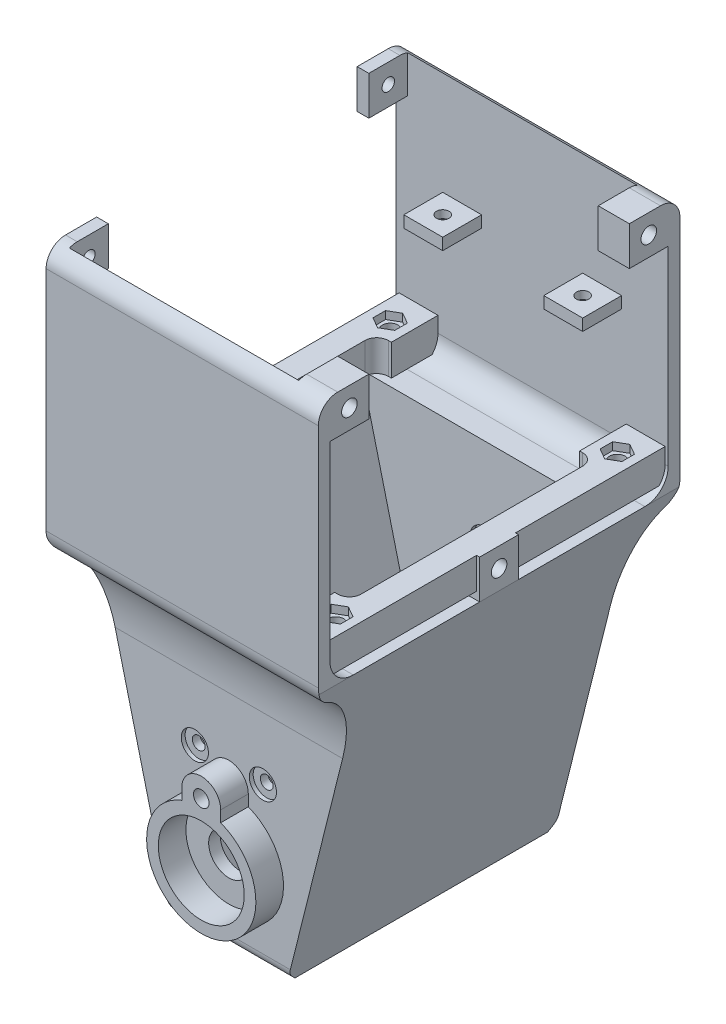
from build123d import *

# Parameters (mm, degrees)
SKETCH1_W                     = 70
SKETCH1_H                     = 145
BOSS_EXTRUDE1_DEPTH           = 3
SKETCH2_R                     = 5.2
SKETCH2_R_2                   = 1.65
CUT_EXTRUDE1_DEPTH            = 10
SKETCH3_W                     = 70
SKETCH3_H                     = 2
BOSS_EXTRUDE3_DEPTH           = 87
SKETCH5_W                     = 70
SKETCH5_H                     = 145
BOSS_EXTRUDE4_DEPTH           = 3
SKETCH6_R                     = 5.2
SKETCH6_R_2                   = 1.65
CUT_EXTRUDE2_DEPTH            = 4
SKETCH7_W                     = 20
SKETCH7_H                     = 4
CUT_EXTRUDE3_DEPTH            = 5
FILLET1_R                     = 2
FILLET2_R                     = 2
FILLET3_R                     = 2
FILLET5_R                     = 2
SKETCH9_R                     = 3.5
CUT_EXTRUDE5_DEPTH            = 1
CUT_EXTRUDE6_START            = -1
SKETCH10_R                    = 3.5
CUT_EXTRUDE6_DEPTH            = 1
SKETCH11_W                    = 8
SKETCH11_H                    = 40
CUT_EXTRUDE7_DEPTH            = 1.2
SKETCH12_W                    = 8
SKETCH12_H                    = 40
CUT_EXTRUDE8_DEPTH            = 1.2
FILLET17_R                    = 4
FILLET18_R                    = 4
CHAMFER1_SIZE                 = 80
CHAMFER1_SIZE2                = 20
CHAMFER2_SIZE                 = 80
CHAMFER2_SIZE2                = 20
CHAMFER3_SIZE                 = 20
CHAMFER3_SIZE2                = 80
CHAMFER4_SIZE                 = 20
CHAMFER4_SIZE2                = 80
SKETCH14_W                    = 75
SKETCH14_H                    = 87
CUT_EXTRUDE9_DEPTH            = 3
SKETCH19_W                    = 10
SKETCH19_H                    = 8
BOSS_EXTRUDE7_DEPTH           = 87
SKETCH20_R                    = 2
CUT_EXTRUDE11_DEPTH           = 6.6
CUT_EXTRUDE12_DEPTH           = 2
SPLIT1_SURFACE_1_BACK         = 186.941
SPLIT1_SURFACE_1_DEPTH        = 373.882
SPLIT1_SURFACE_2_BACK         = 186.941
SPLIT1_SURFACE_2_DEPTH        = 373.882
BODY_MOVE_COPY1_START         = 90
BODY_MOVE_COPY1_OUTLINE_R     = 5.2
BODY_MOVE_COPY1_OUTLINE_R_2   = 1.65
BODY_MOVE_COPY1_DEPTH         = 3
BODY_MOVE_COPY1_START_2       = 78
BODY_MOVE_COPY1_2_OUTLINE_R   = 3.5
BODY_MOVE_COPY1_2_DEPTH       = 3
BODY_MOVE_COPY1_START_3       = 79.2
BODY_MOVE_COPY1_3_DEPTH       = 1.8
BODY_MOVE_COPY1_4_OUTLINE_R   = 3.5
BODY_MOVE_COPY1_4_OUTLINE_R_2 = 1.65
BODY_MOVE_COPY1_4_DEPTH       = 2
BOSS_EXTRUDE11_DEPTH          = 12
BOSS_EXTRUDE12_DEPTH          = 12
FILLET19_SIZE                 = 20
FILLET19_SIZE_2               = 12
FILLET24_SIZE                 = 20
FILLET24_SIZE_2               = 12
BOSS_EXTRUDE14_DEPTH          = 64
SKETCH42_R                    = 11.05
SKETCH42_R_2                  = 2
BOSS_EXTRUDE15_DEPTH          = 7.1
SKETCH43_R                    = 11.05
SKETCH43_R_2                  = 2
BOSS_EXTRUDE16_DEPTH          = 7.1
SKETCH44_R                    = 2
BOSS_EXTRUDE17_DEPTH          = 2.5
SKETCH45_R                    = 2
BOSS_EXTRUDE18_DEPTH          = 2.5
SKETCH48_W                    = 7
SKETCH48_H                    = 10
BOSS_EXTRUDE19_DEPTH          = 10
FILLET38_R                    = 4
SKETCH49_R                    = 1.6
CUT_EXTRUDE15_DEPTH           = 12
SKETCH50_R                    = 2
CUT_EXTRUDE16_DEPTH           = 4.6
FILLET39_R                    = 6
FILLET40_R                    = 6
SKETCH56_W                    = 10
SKETCH56_H                    = 3
SKETCH56_W_2                  = 8
SKETCH56_H_2                  = 10
SKETCH56_W_3                  = 3
BOSS_EXTRUDE24_DEPTH          = 10
SKETCH55_W                    = 10
SKETCH55_H                    = 3
SKETCH55_W_2                  = 3
SKETCH55_H_2                  = 10
SKETCH55_W_3                  = 8
BOSS_EXTRUDE23_DEPTH          = 10
SKETCH57_R                    = 1.6
CUT_EXTRUDE21_DEPTH           = 3
CUT_EXTRUDE18_DEPTH           = 8
SKETCH63_R                    = 2
CUT_EXTRUDE23_DEPTH           = 6.8
SKETCH62_R                    = 1.6
CUT_EXTRUDE22_DEPTH           = 3
FILLET42_R                    = 5
CUT_EXTRUDE24_DEPTH           = 1
CHAMFER5_SIZE                 = 2
FILLET43_R                    = 3


# Read off the part's stored shape, not the designer's step: Body-Move/Copy1
# Some blends are built 0.0001 mm under size
with BuildPart() as part:
    # Sketch1 → Boss-Extrude1 (new body)
    with BuildSketch(Plane.XY):
        with Locations((35, 72.5)):
            Rectangle(SKETCH1_W, SKETCH1_H)
    extrude(amount=BOSS_EXTRUDE1_DEPTH)

    # Sketch2 → Cut-Extrude1 (cut)
    with BuildSketch(Plane.XY.offset(3)):
        with Locations((35, 21)):
            Circle(SKETCH2_R)
        with Locations((26.25, 41)):
            Circle(SKETCH2_R_2)
        with Locations((43.75, 41)):
            Circle(SKETCH2_R_2)
    extrude(amount=-CUT_EXTRUDE1_DEPTH, mode=Mode.SUBTRACT)

    # Sketch3 → Boss-Extrude3 (add)
    with BuildSketch(Plane.XY.offset(3)):
        with Locations((35, 113)):
            Rectangle(SKETCH3_W, SKETCH3_H)
    extrude(amount=BOSS_EXTRUDE3_DEPTH)

    # Sketch5 → Boss-Extrude4 (add)
    with BuildSketch(Plane.XY.offset(90)):
        with Locations((35, 72.5)):
            Rectangle(SKETCH5_W, SKETCH5_H)
    extrude(amount=BOSS_EXTRUDE4_DEPTH)

    # Sketch6 → Cut-Extrude2 (cut)
    with BuildSketch(Plane.XY.offset(93)):
        with Locations((35, 21)):
            Circle(SKETCH6_R)
        with Locations((26.25, 41)):
            Circle(SKETCH6_R_2)
        with Locations((43.75, 41)):
            Circle(SKETCH6_R_2)
    extrude(amount=-CUT_EXTRUDE2_DEPTH, mode=Mode.SUBTRACT)

    # Sketch7 → Cut-Extrude3 (cut)
    with BuildSketch(Plane(origin=(0, 114, 0), x_dir=(1, 0, 0), z_dir=(0, 1, 0))):
        with Locations((35, -88)):
            Rectangle(SKETCH7_W, SKETCH7_H)
        with Locations((35, -5)):
            Rectangle(SKETCH7_W, SKETCH7_H)
    extrude(amount=-CUT_EXTRUDE3_DEPTH, mode=Mode.SUBTRACT)

    # Fillet1
    fillet1_edges = [part.edges().sort_by_distance(p)[0] for p in [
        (25, 113, 86),
    ]]
    fillet(fillet1_edges, radius=FILLET1_R)

    # Fillet2
    fillet2_edges = [part.edges().sort_by_distance(p)[0] for p in [
        (45, 113, 86),
    ]]
    fillet(fillet2_edges, radius=FILLET2_R)

    # Fillet3
    fillet3_edges = [part.edges().sort_by_distance(p)[0] for p in [
        (25, 113, 7),
    ]]
    fillet(fillet3_edges, radius=FILLET3_R)

    # Fillet5
    fillet5_edges = [part.edges().sort_by_distance(p)[0] for p in [
        (45, 113, 7),
    ]]
    fillet(fillet5_edges, radius=FILLET5_R)

    # Sketch9 → Cut-Extrude5 (cut)
    with BuildSketch(Plane.XY.offset(93)):
        with Locations((26.25, 41)):
            Circle(SKETCH9_R)
        with Locations((43.75, 41)):
            Circle(SKETCH9_R)
    extrude(amount=-CUT_EXTRUDE5_DEPTH, mode=Mode.SUBTRACT)

    # Sketch10 → Cut-Extrude6 (cut)
    with BuildSketch(Plane(origin=(0, 0, 0), x_dir=(-1, 0, 0), z_dir=(0, 0, -1)).offset(CUT_EXTRUDE6_START)):
        with Locations(Location((-43.75, 41, 0), (0, 0, 180))):
            Circle(SKETCH10_R)
        with Locations(Location((-26.25, 41, 0), (0, 0, 180))):
            Circle(SKETCH10_R)
    extrude(amount=CUT_EXTRUDE6_DEPTH, mode=Mode.SUBTRACT)

    # Sketch11 → Cut-Extrude7 (cut)
    with BuildSketch(Plane.XY.offset(3)):
        with Locations((35, 41)):
            Rectangle(SKETCH11_W, SKETCH11_H)
    extrude(amount=-CUT_EXTRUDE7_DEPTH, mode=Mode.SUBTRACT)

    # Sketch12 → Cut-Extrude8 (cut)
    with BuildSketch(Plane(origin=(0, 0, 90), x_dir=(-1, 0, 0), z_dir=(0, 0, -1))):
        with Locations((-35, 41)):
            Rectangle(SKETCH12_W, SKETCH12_H)
    extrude(amount=-CUT_EXTRUDE8_DEPTH, mode=Mode.SUBTRACT)

    # Fillet17
    fillet17_edges = [part.edges().sort_by_distance(p)[0] for p in [
        (39, 61, 90.6),
        (31, 61, 90.6),
    ]]
    fillet(fillet17_edges, radius=FILLET17_R - 0.0001)  # a hair under: the kernel refuses the full size

    # Fillet18
    fillet18_edges = [part.edges().sort_by_distance(p)[0] for p in [
        (39, 61, 2.4),
        (31, 61, 2.4),
    ]]
    fillet(fillet18_edges, radius=FILLET18_R - 0.0001)  # a hair under: the kernel refuses the full size

    # Chamfer1
    chamfer1_edges = [part.edges().sort_by_distance(p)[0] for p in [
        (0, 0, 91.5),
    ]]
    chamfer1_side = [part.faces().sort_by_distance(p)[0] for p in [
        (0, 1.722614292, 91.5),
    ]]
    chamfer(chamfer1_edges, length=CHAMFER1_SIZE, length2=CHAMFER1_SIZE2, reference=chamfer1_side[0])

    # Chamfer2
    chamfer2_edges = [part.edges().sort_by_distance(p)[0] for p in [
        (0, 0, 1.5),
    ]]
    chamfer2_side = [part.faces().sort_by_distance(p)[0] for p in [
        (0, 112.5, 91.277385708),
    ]]
    chamfer(chamfer2_edges, length=CHAMFER2_SIZE, length2=CHAMFER2_SIZE2, reference=chamfer2_side[0])

    # Chamfer3
    chamfer3_edges = [part.edges().sort_by_distance(p)[0] for p in [
        (70, 0, 91.5),
    ]]
    chamfer3_side = [part.faces().sort_by_distance(p)[0] for p in [
        (45, 0, 91.5),
    ]]
    chamfer(chamfer3_edges, length=CHAMFER3_SIZE, length2=CHAMFER3_SIZE2, reference=chamfer3_side[0])

    # Chamfer4
    chamfer4_edges = [part.edges().sort_by_distance(p)[0] for p in [
        (70, 0, 1.5),
    ]]
    chamfer4_side = [part.faces().sort_by_distance(p)[0] for p in [
        (45, 0, 1.5),
    ]]
    chamfer(chamfer4_edges, length=CHAMFER4_SIZE, length2=CHAMFER4_SIZE2, reference=chamfer4_side[0])

    # Sketch14 → Cut-Extrude9 (cut)
    with BuildSketch(Plane(origin=(0, 114, 0), x_dir=(1, 0, 0), z_dir=(0, 1, 0))):
        with Locations((37.5, -46.5)):
            Rectangle(SKETCH14_W, SKETCH14_H)
    extrude(amount=-CUT_EXTRUDE9_DEPTH, mode=Mode.SUBTRACT)


with BuildPart() as cut_extrude9_piece_1:
    # of the separate pieces the step leaves, piece 1, a body of its own (cut_extrude9_pieces)
    add(part.part.solids().sort_by_distance((70, 80, 90))[0])



with BuildPart() as cut_extrude9_piece_2:
    # of the separate pieces the step leaves, piece 2, a body of its own (cut_extrude9_pieces)
    add(part.part.solids().sort_by_distance((70, 145, 3))[0])


with BuildPart() as cut_extrude9_piece_1_1:
    add(cut_extrude9_piece_1.part)

    add(cut_extrude9_piece_2.part)  # Boss-Extrude7 merges Cut-Extrude9 piece 2
    # Sketch19 → Boss-Extrude7 (add)
    with BuildSketch(Plane(origin=(0, 0, 90), x_dir=(-1, 0, 0), z_dir=(0, 0, -1))):
        with Locations((-64.21, 86)):
            Rectangle(SKETCH19_W, SKETCH19_H)
        with Locations((-5.79, 86)):
            Rectangle(SKETCH19_W, SKETCH19_H)
    extrude(amount=BOSS_EXTRUDE7_DEPTH)

    # Sketch20 → Cut-Extrude11 (cut)
    with BuildSketch(Plane(origin=(0, 90, 0), x_dir=(1, 0, 0), z_dir=(0, 1, 0))):
        with Locations(Location((64.21, -10.305, 0), (0, 0, 270))):
            Circle(SKETCH20_R)
        with Locations(Location((64.21, -82.695, 0), (0, 0, 270))):
            Circle(SKETCH20_R)
        with Locations(Location((5.79, -10.305, 0), (0, 0, 270))):
            Circle(SKETCH20_R)
        with Locations(Location((5.79, -82.695, 0), (0, 0, 270))):
            Circle(SKETCH20_R)
    extrude(amount=-CUT_EXTRUDE11_DEPTH, mode=Mode.SUBTRACT)

    # Sketch22 → Cut-Extrude12 (cut)
    with BuildSketch(Plane(origin=(0, 90, 0), x_dir=(1, 0, 0), z_dir=(0, 1, 0))):
        Polygon((2.99, -8.688419246), (2.99, -11.921580754), (5.79, -13.538161507), (8.59, -11.921580754), (8.59, -8.688419246), (5.79, -7.071838493), align=None)
        Polygon((61.41, -8.688419246), (61.41, -11.921580754), (64.21, -13.538161507), (67.01, -11.921580754), (67.01, -8.688419246), (64.21, -7.071838493), align=None)
        Polygon((67.01, -81.078419246), (64.21, -79.461838493), (61.41, -81.078419246), (61.41, -84.311580754), (64.21, -85.928161507), (67.01, -84.311580754), align=None)
        Polygon((2.99, -81.078419246), (2.99, -84.311580754), (5.79, -85.928161507), (8.59, -84.311580754), (8.59, -81.078419246), (5.79, -79.461838493), align=None)
    extrude(amount=-CUT_EXTRUDE12_DEPTH, mode=Mode.SUBTRACT)


with BuildPart() as body_2:
    # Split1: the piece behind the surface
    add(cut_extrude9_piece_1_1.part)
    # Split1 surface: a surface, the sketch's curves swept straight by 373.882 mm
    with BuildLine(Plane.XY.offset(-SPLIT1_SURFACE_1_BACK), mode=Mode.PRIVATE) as split1_surface_1_path:
        Line((70, 80), (0, 80))
    split1_surface_1 = Shell.extrude(split1_surface_1_path.wire(), (0 * SPLIT1_SURFACE_1_DEPTH, 0 * SPLIT1_SURFACE_1_DEPTH, 1 * SPLIT1_SURFACE_1_DEPTH))
    split(bisect_by=split1_surface_1, keep=Keep.BOTTOM)



with BuildPart() as cut_extrude9_piece_1_2:
    add(cut_extrude9_piece_1_1.part)

    # Split1: split by a surface, the side it looks to stays
    # Split1 surface: a surface, the sketch's curves swept straight by 373.882 mm
    with BuildLine(Plane.XY.offset(-SPLIT1_SURFACE_2_BACK), mode=Mode.PRIVATE) as split1_surface_2_path:
        Line((70, 80), (0, 80))
    split1_surface_2 = Shell.extrude(split1_surface_2_path.wire(), (0 * SPLIT1_SURFACE_2_DEPTH, 0 * SPLIT1_SURFACE_2_DEPTH, 1 * SPLIT1_SURFACE_2_DEPTH))
    split(bisect_by=split1_surface_2, keep=Keep.TOP)

    # Body-Move/Copy1 outline → Body-Move/Copy1 (cut)
    with BuildSketch(Plane.XY.offset(BODY_MOVE_COPY1_START)):
        Polygon((50, 0), (70, 80), (0, 80), (20, 0), align=None)
        with Locations((35, 21)):
            Circle(BODY_MOVE_COPY1_OUTLINE_R, mode=Mode.SUBTRACT)
        with Locations((26.25, 41)):
            Circle(BODY_MOVE_COPY1_OUTLINE_R_2, mode=Mode.SUBTRACT)
        with Locations((43.75, 41)):
            Circle(BODY_MOVE_COPY1_OUTLINE_R_2, mode=Mode.SUBTRACT)
    extrude(amount=BODY_MOVE_COPY1_DEPTH, mode=Mode.SUBTRACT)


with BuildPart() as body_3:
    # Body-Move_Copy1 2 outline → Body-Move_Copy1 2 (new body)
    with BuildSketch(Plane.XY.offset(BODY_MOVE_COPY1_START_2)):
        Polygon((50, 0), (70, 80), (0, 80), (20, 0), align=None)
        with BuildLine():
            Line((31, 24.322649545), (31, 57))
            ThreePointArc((31, 57), (32.171572875, 59.828427125), (35, 61))
            ThreePointArc((35, 61), (37.828427125, 59.828427125), (39, 57))
            Line((39, 57), (39, 24.322649545))
            ThreePointArc((39, 24.322649545), (35, 15.8), (31, 24.322649545))
        make_face(mode=Mode.SUBTRACT)
        with Locations((26.25, 41)):
            Circle(BODY_MOVE_COPY1_2_OUTLINE_R, mode=Mode.SUBTRACT)
        with Locations((43.75, 41)):
            Circle(BODY_MOVE_COPY1_2_OUTLINE_R, mode=Mode.SUBTRACT)
    extrude(amount=BODY_MOVE_COPY1_2_DEPTH)

    # Body-Move_Copy1 3 outline → Body-Move_Copy1 3 (add)
    with BuildSketch(Plane.XY.offset(BODY_MOVE_COPY1_START_3)):
        with BuildLine():
            ThreePointArc((35, 61), (32.171572875, 59.828427125), (31, 57))
            Line((31, 57), (31, 24.322649545))
            ThreePointArc((31, 24.322649545), (35, 26.2), (39, 24.322649545))
            Line((39, 24.322649545), (39, 57))
            ThreePointArc((39, 57), (37.828427125, 59.828427125), (35, 61))
        make_face()
    extrude(amount=BODY_MOVE_COPY1_3_DEPTH)

    # Body-Move_Copy1 4 outline → Body-Move_Copy1 4 (add)
    # profile 1 of 2: a face of its own
    with BuildSketch(Plane.XY.offset(BODY_MOVE_COPY1_START_2)):
        with Locations((43.75, 41)):
            Circle(BODY_MOVE_COPY1_4_OUTLINE_R)
        with Locations((43.75, 41)):
            Circle(BODY_MOVE_COPY1_4_OUTLINE_R_2, mode=Mode.SUBTRACT)
    # profile 2 of 2: a face of its own
    with BuildSketch(Plane.XY.offset(BODY_MOVE_COPY1_START_2)):
        with Locations((26.25, 41)):
            Circle(BODY_MOVE_COPY1_4_OUTLINE_R)
        with Locations((26.25, 41)):
            Circle(BODY_MOVE_COPY1_4_OUTLINE_R_2, mode=Mode.SUBTRACT)
    extrude(amount=BODY_MOVE_COPY1_4_DEPTH)


with BuildPart() as cut_extrude9_piece_1_3:
    # Body-Move/Copy2: moved
    add(cut_extrude9_piece_1_2.part.moved(Location((0, 0, 12))))



with BuildPart() as body_2_1:
    add(body_2.part)

    add(body_3.part)  # Boss-Extrude11 merges body 3
    # Sketch35 → Boss-Extrude11 (add)
    with BuildSketch(Plane.XY.offset(81)):
        Polygon((0.75, 77), (69.25, 77), (70, 80), (0, 80), align=None)
    extrude(amount=BOSS_EXTRUDE11_DEPTH)


with BuildPart() as cut_extrude9_piece_1_4:
    add(cut_extrude9_piece_1_3.part)

    add(body_2_1.part)  # Boss-Extrude12 merges body 2
    # Sketch36 → Boss-Extrude12 (add)
    with BuildSketch(Plane(origin=(0, 0, 12), x_dir=(-1, 0, 0), z_dir=(0, 0, -1))):
        Polygon((-69.25, 77), (-0.75, 77), (0, 80), (-70, 80), align=None)
    extrude(amount=BOSS_EXTRUDE12_DEPTH)

    # Fillet19
    # an asymmetric fillet: 20, 12 mm, written as the material it adds along each edge
    with BuildSketch(Plane(origin=(-49.25, 77, 81), x_dir=(0, -1, 0), z_dir=(1, 0, 0))) as fillet19_piece_1_section:
        with BuildLine():
            Bezier((FILLET19_SIZE, 0), (0, 0), (0, -FILLET19_SIZE_2), weights=[1, 0.707106781, 1])
            Line((0, -FILLET19_SIZE_2), (0, 0))
            Line((0, 0), (FILLET19_SIZE, 0))
        make_face()
    fillet19_piece_1 = extrude(amount=168.5, mode=Mode.PRIVATE)
    fillet19_piece_1 = split(fillet19_piece_1, bisect_by=Plane(origin=(66.144010616, 64.576042464, 83.616125615), z_dir=(-0.9701425001453319, 0.24253562503633297, 0)), keep=Keep.TOP, mode=Mode.PRIVATE)
    fillet19_piece_1 = split(fillet19_piece_1, bisect_by=Plane(origin=(3.855990617, 64.576037532, 83.616125615), z_dir=(0.9701425001453319, 0.24253562503633297, 0)), keep=Keep.TOP, mode=Mode.PRIVATE)
    add(fillet19_piece_1)

    # Fillet24
    # an asymmetric fillet: 20, 12 mm, written as the material it adds along each edge
    with BuildSketch(Plane(origin=(119.25, 77, 12), x_dir=(0, -1, 0), z_dir=(-1, 0, 0))) as fillet24_piece_1_section:
        with BuildLine():
            Bezier((FILLET24_SIZE, 0), (0, 0), (0, -FILLET24_SIZE_2), weights=[1, 0.707106781, 1])
            Line((0, -FILLET24_SIZE_2), (0, 0))
            Line((0, 0), (FILLET24_SIZE, 0))
        make_face()
    fillet24_piece_1 = extrude(amount=168.5, mode=Mode.PRIVATE)
    fillet24_piece_1 = split(fillet24_piece_1, bisect_by=Plane(origin=(3.85598727, 64.576050922, 9.383876989), z_dir=(0.9701425001453319, 0.24253562503633297, 0)), keep=Keep.TOP, mode=Mode.PRIVATE)
    fillet24_piece_1 = split(fillet24_piece_1, bisect_by=Plane(origin=(66.14401273, 64.576050922, 9.383876989), z_dir=(-0.970142500145332, 0.24253562503633283, 0)), keep=Keep.TOP, mode=Mode.PRIVATE)
    add(fillet24_piece_1)

    # Sketch41 → Boss-Extrude14 (add)
    with BuildSketch(Plane(origin=(0, 0, 78), x_dir=(-1, 0, 0), z_dir=(0, 0, -1))):
        Polygon((-66.907670781, 80), (-47.657670781, 3), (-22.342329219, 3), (-3.092329219, 80), (0, 80), (-20, 0), (-50, 0), (-70, 80), align=None)
    extrude(amount=BOSS_EXTRUDE14_DEPTH)

    # Sketch42 → Boss-Extrude15 (add)
    with BuildSketch(Plane.XY.offset(81)):
        with BuildLine():
            Line((40, 37), (40, 34.13021325))
            ThreePointArc((40, 34.13021325), (35, 6.95), (30, 34.13021325))
            Line((30, 34.13021325), (30, 37))
            ThreePointArc((30, 37), (35, 42), (40, 37))
        make_face()
        with Locations((35, 21)):
            Circle(SKETCH42_R, mode=Mode.SUBTRACT)
        with Locations((35, 37)):
            Circle(SKETCH42_R_2, mode=Mode.SUBTRACT)
    extrude(amount=BOSS_EXTRUDE15_DEPTH)

    # Sketch43 → Boss-Extrude16 (add)
    with BuildSketch(Plane(origin=(0, 0, 12), x_dir=(-1, 0, 0), z_dir=(0, 0, -1))):
        with BuildLine():
            Line((-30, 37), (-30, 34.13021325))
            ThreePointArc((-30, 34.13021325), (-35, 6.95), (-40, 34.13021325))
            Line((-40, 34.13021325), (-40, 37))
            ThreePointArc((-40, 37), (-35, 42), (-30, 37))
        make_face()
        with Locations(Location((-35, 21, 0), (0, 0, 180))):
            Circle(SKETCH43_R, mode=Mode.SUBTRACT)
        with Locations(Location((-35, 37, 0), (0, 0, 180))):
            Circle(SKETCH43_R_2, mode=Mode.SUBTRACT)
    extrude(amount=BOSS_EXTRUDE16_DEPTH)

    # Sketch44 → Boss-Extrude17 (add)
    with BuildSketch(Plane.XY.offset(81)):
        with Locations((35, 37)):
            Circle(SKETCH44_R)
    extrude(amount=BOSS_EXTRUDE17_DEPTH)

    # Sketch45 → Boss-Extrude18 (add)
    with BuildSketch(Plane(origin=(0, 0, 12), x_dir=(-1, 0, 0), z_dir=(0, 0, -1))):
        with Locations(Location((-35, 37, 0), (0, 0, 180))):
            Circle(SKETCH45_R)
    extrude(amount=BOSS_EXTRUDE18_DEPTH)

    # Sketch48 → Boss-Extrude19 (add)
    with BuildSketch(Plane(origin=(0, 80, 0), x_dir=(1, 0, 0), z_dir=(0, 1, 0))):
        with Locations((3.5, -46.5)):
            Rectangle(SKETCH48_W, SKETCH48_H)
        with Locations((66.5, -46.5)):
            Rectangle(SKETCH48_W, SKETCH48_H)
    extrude(amount=BOSS_EXTRUDE19_DEPTH)

    # Fillet38
    # the kernel refuses this fillet: 4 mm, written as the material it adds along each edge
    with BuildSketch(Plane(origin=(3.092329219, 80, 51.5), x_dir=(0.24253562503632958, -0.9701425001453328, 0), z_dir=(0, 0, -1))) as fillet38_piece_1:
        with BuildLine():
            CenterArc((4.942285388, -4), FILLET38_R, 90, 87.004895833)
            Line((0.947749375, -3.790997501), (0, 0))
            Line((0, 0), (4.942285388, 0))
        make_face()
    extrude(amount=10)
    with BuildSketch(Plane(origin=(66.907670781, 80, 51.5), x_dir=(-0.2425356250363303, -0.9701425001453327, 0), z_dir=(0, 0, -1))) as fillet38_piece_2:
        with BuildLine():
            CenterArc((4.942285388, 4), FILLET38_R, 182.995104167, 87.004895833)
            Line((0.947749375, 3.790997501), (0, 0))
            Line((0, 0), (4.942285388, 0))
        make_face()
    extrude(amount=10)

    # Sketch49 → Cut-Extrude15 (cut)
    with BuildSketch(Plane.ZY):
        with Locations(Location((46.5, 85, 0), (0, 0, 270))):
            Circle(SKETCH49_R)
    extrude(amount=-CUT_EXTRUDE15_DEPTH, mode=Mode.SUBTRACT)

    # Sketch50 → Cut-Extrude16 (cut)
    with BuildSketch(Plane(origin=(70, 0, 0), x_dir=(0, 0, -1), z_dir=(1, 0, 0))):
        with Locations(Location((-46.5, 85, 0), (0, 0, 90))):
            Circle(SKETCH50_R)
    extrude(amount=-CUT_EXTRUDE16_DEPTH, mode=Mode.SUBTRACT)

    # Fillet39
    # the kernel refuses this fillet: 6 mm, written as the material it adds along each edge
    with BuildSketch(Plane(origin=(0, 80, 3), x_dir=(0, 0, 1), z_dir=(1, 0, 0))) as fillet39_piece_1_section:
        with BuildLine():
            CenterArc((FILLET39_R, -FILLET39_R), FILLET39_R, 90, 90)
            Line((0, -FILLET39_R), (0, 0))
            Line((0, 0), (FILLET39_R, 0))
        make_face()
    fillet39_piece_1 = extrude(amount=70, mode=Mode.PRIVATE)
    fillet39_piece_1 = split(fillet39_piece_1, bisect_by=Plane(origin=(1.739195294, 73.043218826, 4.358316457), z_dir=(0.9701425001453908, 0.2425356250360977, 0)), keep=Keep.TOP, mode=Mode.PRIVATE)
    fillet39_piece_1 = split(fillet39_piece_1, bisect_by=Plane(origin=(68.260804706, 73.043218826, 4.358316457), z_dir=(-0.9701425001453908, 0.2425356250360977, 0)), keep=Keep.TOP, mode=Mode.PRIVATE)
    add(fillet39_piece_1)
    with BuildSketch(Plane(origin=(70, 80, 90), x_dir=(0, 0, -1), z_dir=(-1, 0, 0))) as fillet39_piece_2_section:
        with BuildLine():
            CenterArc((FILLET39_R, -FILLET39_R), FILLET39_R, 90, 90)
            Line((0, -FILLET39_R), (0, 0))
            Line((0, 0), (FILLET39_R, 0))
        make_face()
    fillet39_piece_2 = extrude(amount=70, mode=Mode.PRIVATE)
    fillet39_piece_2 = split(fillet39_piece_2, bisect_by=Plane(origin=(1.739195294, 73.043218826, 88.641683543), z_dir=(0.9701425001453908, 0.2425356250360977, 0)), keep=Keep.TOP, mode=Mode.PRIVATE)
    fillet39_piece_2 = split(fillet39_piece_2, bisect_by=Plane(origin=(68.260804706, 73.043218826, 88.641683543), z_dir=(-0.9701425001453908, 0.2425356250360977, 0)), keep=Keep.TOP, mode=Mode.PRIVATE)
    add(fillet39_piece_2)

    # Fillet40
    fillet40_edges = [cut_extrude9_piece_1_4.edges().sort_by_distance(p)[0] for p in [
        (35, 77, 0),
        (35, 77, 93),
    ]]
    fillet(fillet40_edges, radius=FILLET40_R)

    # Sketch56 → Boss-Extrude24 (add)
    with BuildSketch(Plane(origin=(0, 0, 90), x_dir=(-1, 0, 0), z_dir=(0, 0, -1))):
        with Locations((-53, 116.5)):
            Rectangle(SKETCH56_W, SKETCH56_H)
        with Locations((-17, 116.5)):
            Rectangle(SKETCH56_W, SKETCH56_H)
        with Locations((-66, 140)):
            Rectangle(SKETCH56_W_2, SKETCH56_H_2)
        with Locations((-1.5, 140)):
            Rectangle(SKETCH56_W_3, SKETCH56_H_2)
    extrude(amount=BOSS_EXTRUDE24_DEPTH)

    # Sketch55 → Boss-Extrude23 (add)
    with BuildSketch(Plane.XY.offset(3)):
        with Locations((17, 116.5)):
            Rectangle(SKETCH55_W, SKETCH55_H)
        with Locations((53, 116.5)):
            Rectangle(SKETCH55_W, SKETCH55_H)
        with Locations((1.5, 140)):
            Rectangle(SKETCH55_W_2, SKETCH55_H_2)
        with Locations((66, 140)):
            Rectangle(SKETCH55_W_3, SKETCH55_H_2)
    extrude(amount=BOSS_EXTRUDE23_DEPTH)

    # Sketch57 → Cut-Extrude21 (cut)
    with BuildSketch(Plane(origin=(0, 118, 0), x_dir=(1, 0, 0), z_dir=(0, 1, 0))):
        with Locations(Location((17, -8, 0), (0, 0, 270))):
            Circle(SKETCH57_R)
        with Locations(Location((53, -85, 0), (0, 0, 270))):
            Circle(SKETCH57_R)
        with Locations(Location((53, -8, 0), (0, 0, 270))):
            Circle(SKETCH57_R)
        with Locations(Location((17, -85, 0), (0, 0, 270))):
            Circle(SKETCH57_R)
    extrude(amount=-CUT_EXTRUDE21_DEPTH, mode=Mode.SUBTRACT)

    # Sketch60 → Cut-Extrude18 (cut)
    with BuildSketch(Plane(origin=(0, 90, 0), x_dir=(1, 0, 0), z_dir=(0, 1, 0))):
        with BuildLine():
            Line((63, -18), (63, -75))
            ThreePointArc((63, -75), (62.121320344, -77.121320344), (60, -78))
            Line((60, -78), (59.21, -78))
            Line((59.21, -78), (59.21, -15))
            Line((59.21, -15), (60, -15))
            ThreePointArc((60, -15), (62.121320344, -15.878679656), (63, -18))
        make_face()
        with BuildLine():
            Line((10.79, -15), (10, -15))
            ThreePointArc((10, -15), (7.878679656, -15.878679656), (7, -18))
            Line((7, -18), (7, -75))
            ThreePointArc((7, -75), (7.878679656, -77.121320344), (10, -78))
            Line((10, -78), (10.79, -78))
            Line((10.79, -78), (10.79, -15))
        make_face()
    extrude(amount=-CUT_EXTRUDE18_DEPTH, mode=Mode.SUBTRACT)

    # Sketch63 → Cut-Extrude23 (cut)
    with BuildSketch(Plane(origin=(70, 0, 0), x_dir=(0, 0, -1), z_dir=(1, 0, 0))):
        with Locations((-8, 140)):
            Circle(SKETCH63_R)
        with Locations((-85, 140)):
            Circle(SKETCH63_R)
    extrude(amount=-CUT_EXTRUDE23_DEPTH, mode=Mode.SUBTRACT)

    # Sketch62 → Cut-Extrude22 (cut)
    with BuildSketch(Plane.ZY):
        with Locations((85, 140)):
            Circle(SKETCH62_R)
        with Locations((8, 140)):
            Circle(SKETCH62_R)
    extrude(amount=-CUT_EXTRUDE22_DEPTH, mode=Mode.SUBTRACT)

    # Fillet42
    # the kernel refuses this fillet: 5 mm, written as the material it takes off along each edge
    with BuildSketch(Plane(origin=(-12.5, 145, 93), x_dir=(0, -1, 0), z_dir=(1, 0, 0)), Plane(origin=(82.5, 145, 0), x_dir=(0, -1, 0), z_dir=(-1, 0, 0))) as fillet42_piece_1:
        with BuildLine():
            CenterArc((FILLET42_R, FILLET42_R), FILLET42_R, 180, 90)
            Line((0, FILLET42_R), (0, 0))
            Line((0, 0), (FILLET42_R, 0))
        make_face()
    extrude(amount=95, mode=Mode.SUBTRACT)

    # Sketch64 → Cut-Extrude24 (cut)
    with BuildSketch(Plane.XZ.offset(-115)):
        Polygon((50.2, 6.383419246), (53, 4.766838493), (55.8, 6.383419246), (55.8, 9.616580754), (53, 11.233161507), (50.2, 9.616580754), align=None)
        Polygon((19.8, 9.616580754), (17, 11.233161507), (14.2, 9.616580754), (14.2, 6.383419246), (17, 4.766838493), (19.8, 6.383419246), align=None)
        Polygon((19.8, 86.616580754), (17, 88.233161507), (14.2, 86.616580754), (14.2, 83.383419246), (17, 81.766838493), (19.8, 83.383419246), align=None)
        Polygon((55.8, 86.616580754), (53, 88.233161507), (50.2, 86.616580754), (50.2, 83.383419246), (53, 81.766838493), (55.8, 83.383419246), align=None)
    extrude(amount=-CUT_EXTRUDE24_DEPTH, mode=Mode.SUBTRACT)

    # Chamfer5
    chamfer5_edges = [cut_extrude9_piece_1_4.edges().sort_by_distance(p)[0] for p in [
        (35, 0, 81),
        (35, 0, 12),
    ]]
    chamfer(chamfer5_edges, length=CHAMFER5_SIZE)

    # Fillet43
    fillet43_edges = [cut_extrude9_piece_1_4.edges().sort_by_distance(p)[0] for p in [
        (35, 2, 81),
        (35, 2, 12),
    ]]
    fillet(fillet43_edges, radius=FILLET43_R)


solid = cut_extrude9_piece_1_4.part
